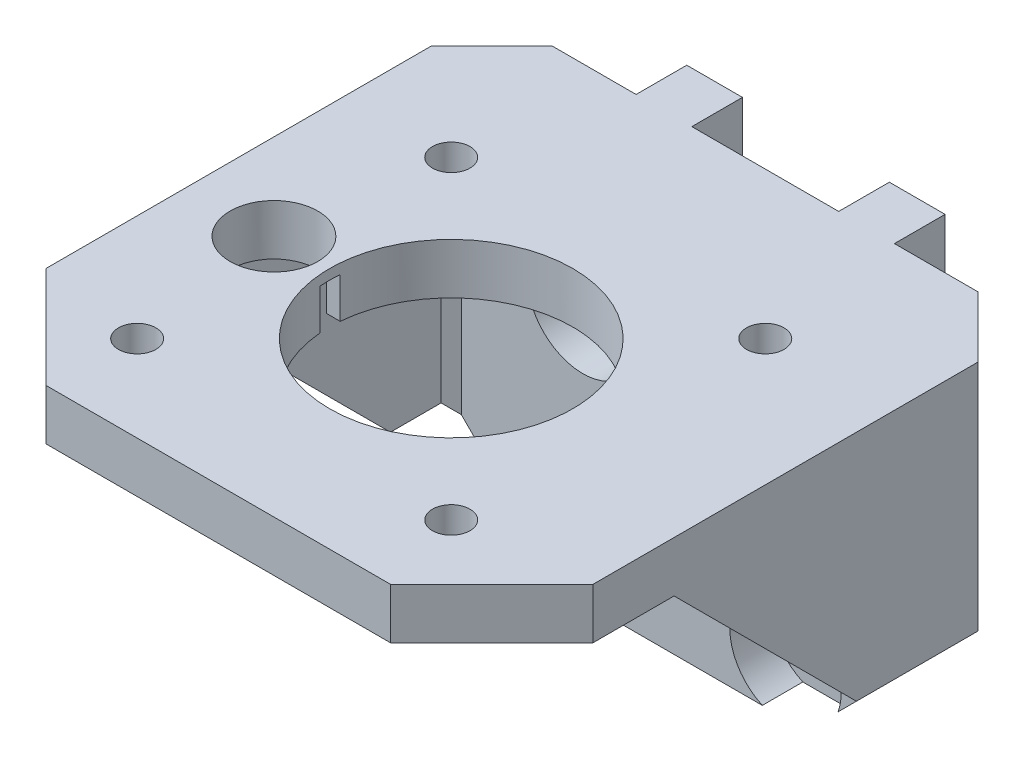
from build123d import *

# Parameters (mm, degrees)
SKETCH1_W           = 54
SKETCH1_H           = 54
BOSS_EXTRUDE1_DEPTH = 5
SKETCH3_W           = 54
SKETCH3_H           = 38
BOSS_EXTRUDE2_DEPTH = 8
SKETCH9_W           = 5.5
SKETCH9_H           = 5
BOSS_EXTRUDE3_DEPTH = 7
SKETCH2_R           = 12
SKETCH2_R_2         = 4.325
SKETCH2_R_3         = 1.85
CUT_EXTRUDE1_DEPTH  = 5
SKETCH4_R           = 2.575
CUT_EXTRUDE2_DEPTH  = 8
SKETCH7_R           = 5.5
CUT_EXTRUDE3_DEPTH  = 4
SKETCH8_W           = 4.486421388
SKETCH8_H           = 2
CUT_EXTRUDE4_DEPTH  = 4
RIB1_REACH          = 72.915
SKETCH5_WALL_W      = 183.428864958
SKETCH5_WALL_H      = 4
RIB9_REACH          = 72.915
SKETCH6_WALL_W      = 183.428864958
SKETCH6_WALL_H      = 6
CHAMFER1_SIZE       = 10
CHAMFER2_SIZE       = 15
CHAMFER3_SIZE       = 15
CHAMFER4_SIZE       = 1
CHAMFER6_SIZE       = 6
LPATTERN2_COUNT     = 2
LPATTERN2_PITCH     = 19.5
CHAMFER7_SIZE       = 2
CHAMFER8_SIZE       = 5


# Some blends are built 0.0001 mm under size
with BuildPart() as part:
    # Sketch1 → Boss-Extrude1 (new body)
    with BuildSketch(Plane(origin=(0, 0, 0), x_dir=(1, 0, 0), z_dir=(0, 1, 0))):
        Rectangle(SKETCH1_W, SKETCH1_H)
    extrude(amount=BOSS_EXTRUDE1_DEPTH)

    # Sketch3 → Boss-Extrude2 (add)
    with BuildSketch(Plane(origin=(0, 0, -27), x_dir=(-1, 0, 0), z_dir=(0, 0, -1))):
        with Locations((0, -14)):
            Rectangle(SKETCH3_W, SKETCH3_H)
    extrude(amount=-BOSS_EXTRUDE2_DEPTH)

    # Sketch9 → Boss-Extrude3 (add)
    with BuildSketch(Plane(origin=(0, 5, 0), x_dir=(1, 0, 0), z_dir=(0, 1, 0))):
        with Locations((10, 29.5)):
            Rectangle(SKETCH9_W, SKETCH9_H)
        with Locations((-10, 29.5)):
            Rectangle(SKETCH9_W, SKETCH9_H)
    boss_extrude3 = extrude(amount=-BOSS_EXTRUDE3_DEPTH)

    # Sketch2 → Cut-Extrude1 (cut)
    with BuildSketch(Plane(origin=(0, 5, 0), x_dir=(1, 0, 0), z_dir=(0, 1, 0))):
        with Locations(Location((-1, -3, 0), (0, 0, 270))):
            Circle(SKETCH2_R)
        with Locations(Location((-18.5, -3, 0), (0, 0, 270))):
            Circle(SKETCH2_R_2)
        with Locations(Location((14.5, 12.5, 0), (0, 0, 270))):
            Circle(SKETCH2_R_3)
        with Locations(Location((-16.5, 12.5, 0), (0, 0, 270))):
            Circle(SKETCH2_R_3)
        with Locations(Location((-16.5, -18.5, 0), (0, 0, 270))):
            Circle(SKETCH2_R_3)
        with Locations(Location((14.5, -18.5, 0), (0, 0, 270))):
            Circle(SKETCH2_R_3)
    extrude(amount=-CUT_EXTRUDE1_DEPTH, mode=Mode.SUBTRACT)

    # Sketch4 → Cut-Extrude2 (cut)
    with BuildSketch(Plane.XY.offset(-19)):
        with Locations((-10, -8)):
            Circle(SKETCH4_R)
        with Locations((10, -8)):
            Circle(SKETCH4_R)
        with Locations((10, -28)):
            Circle(SKETCH4_R)
        with Locations((-10, -28)):
            Circle(SKETCH4_R)
    extrude(amount=-CUT_EXTRUDE2_DEPTH, mode=Mode.SUBTRACT)

    # Sketch7 → Cut-Extrude3 (cut)
    with BuildSketch(Plane.XY.offset(-19)):
        with Locations((-10, -8)):
            Circle(SKETCH7_R)
        with Locations((10, -8)):
            Circle(SKETCH7_R)
        with Locations((10, -28)):
            Circle(SKETCH7_R)
        with Locations((-10, -28)):
            Circle(SKETCH7_R)
    extrude(amount=-CUT_EXTRUDE3_DEPTH, mode=Mode.SUBTRACT)

    # Sketch8 → Cut-Extrude4 (cut)
    with BuildSketch(Plane.XZ):
        with Locations((-13.778117046, 3)):
            Rectangle(SKETCH8_W, SKETCH8_H)
    extrude(amount=-CUT_EXTRUDE4_DEPTH, mode=Mode.SUBTRACT)

    # Sketch5 wall → Rib1 (add, up to next)
    with BuildSketch(Plane(origin=(-27, -14, -5), x_dir=(0, -0.707106781187, -0.707106781187), z_dir=(0, -0.707106781187, 0.707106781187)), mode=Mode.PRIVATE) as rib1_sk1:
        with Locations((0, 2)):
            Rectangle(SKETCH5_WALL_W, SKETCH5_WALL_H)
    rib1_tool1 = extrude(rib1_sk1.sketch, amount=-RIB1_REACH, mode=Mode.PRIVATE) - part.part
    add(rib1_tool1.solids().sort_by_distance((-27, -14, -5))[0])

    # Sketch6 wall → Rib9 (add, up to next)
    with BuildSketch(Plane(origin=(27, -14, -5), x_dir=(0, -0.707106781187, -0.707106781187), z_dir=(0, 0.707106781187, -0.707106781187)), mode=Mode.PRIVATE) as rib9_sk1:
        with Locations((0, 3)):
            Rectangle(SKETCH6_WALL_W, SKETCH6_WALL_H)
    rib9_tool1 = extrude(rib9_sk1.sketch, amount=RIB9_REACH, mode=Mode.PRIVATE) - part.part
    add(rib9_tool1.solids().sort_by_distance((27, -14, -5))[0])

    # Chamfer1
    chamfer1_edges = [part.edges().sort_by_distance(p)[0] for p in [
        (27, 2.5, 27),
        (-27, 2.5, 27),
    ]]
    chamfer(chamfer1_edges, length=CHAMFER1_SIZE)

    # Chamfer2
    # the kernel refuses this chamfer: 15 mm, written as the material it takes off along each edge
    with BuildSketch(Plane(origin=(27, -33, -65.575244819), x_dir=(-0.9996219169112968, -0.02749587661058632, 0), z_dir=(0, 0, 1))) as chamfer2_piece_1:
        Polygon((CHAMFER2_SIZE * 0.999621916911, -CHAMFER2_SIZE * 0.0274958766106), (-CHAMFER2_SIZE * 0.0274958766106, -CHAMFER2_SIZE * 0.999621916911), (0, 0), align=None)
    extrude(amount=85.150489639, mode=Mode.SUBTRACT)

    # Chamfer3
    # the kernel refuses this chamfer: 15 mm, written as the material it takes off along each edge
    with BuildSketch(Plane(origin=(-27, -33, -65.575244819), x_dir=(-0.02749587661058632, 0.9996219169112968, 0), z_dir=(0, 0, 1))) as chamfer3_piece_1:
        Polygon((CHAMFER3_SIZE * 0.999621916911, -CHAMFER3_SIZE * 0.0274958766106), (-CHAMFER3_SIZE * 0.0274958766106, -CHAMFER3_SIZE * 0.999621916911), (0, 0), align=None)
    extrude(amount=85.150489639, mode=Mode.SUBTRACT)

    # Chamfer4
    chamfer4_edges = [part.edges().sort_by_distance(p)[0] for p in [
        (21, -12, -19),
        (-23, -11, -19),
    ]]
    chamfer(chamfer4_edges, length=CHAMFER4_SIZE)

    # Chamfer6
    chamfer6_edges = [part.edges().sort_by_distance(p)[0] for p in [
        (-27, -6.5, -27),
        (27, -6.5, -27),
    ]]
    chamfer(chamfer6_edges, length=CHAMFER6_SIZE)

    # LPattern2: Boss-Extrude3 ×2
    with Locations(*[(0, -i * LPATTERN2_PITCH, 0) for i in range(1, LPATTERN2_COUNT)]):
        add(boss_extrude3)

    # Chamfer7
    chamfer7_edges = [part.edges().sort_by_distance(p)[0] for p in [
        (10, -2, -32),
        (-10, -2, -32),
    ]]
    chamfer(chamfer7_edges, length=CHAMFER7_SIZE)

    # Chamfer8
    chamfer8_edges = [part.edges().sort_by_distance(p)[0] for p in [
        (10, -14.5, -32),
        (-10, -14.5, -32),
    ]]
    chamfer(chamfer8_edges, length=CHAMFER8_SIZE - 0.0001)  # a hair under: the kernel refuses the full size


solid = part.part
